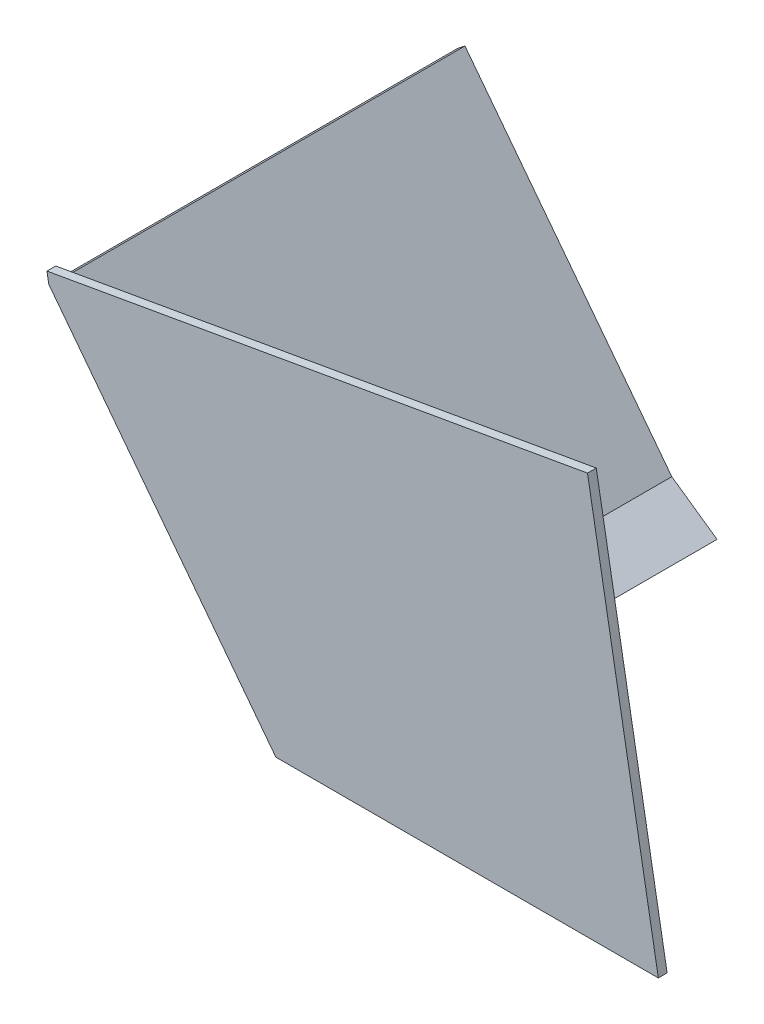
from build123d import *

# Parameters (mm, degrees)
BOSS_EXTRUDE1_DEPTH = 290
BOSS_EXTRUDE2_DEPTH = 6.35


with BuildPart() as part:
    # Sketch1 → Boss-Extrude1 (new body)
    with BuildSketch(Plane.XY):
        Polygon((-162.685454471, 22.943057454), (-312.490020278, 218.17216858), (-317.527813988, 214.306533506), (-153.084627129, 0), (-129.9193727, 0), align=None)
    extrude(amount=BOSS_EXTRUDE1_DEPTH)

    # Sketch2 → Boss-Extrude2 (add)
    with BuildSketch(Plane.XY.offset(290)):
        Polygon((-153.084627129, 0), (-317.527813988, 214.306533506), (-318.884203872, 221.999002792), (72.599266499, 291.02810112), (123.915372871, 0), align=None)
    extrude(amount=BOSS_EXTRUDE2_DEPTH)


solid = part.part
